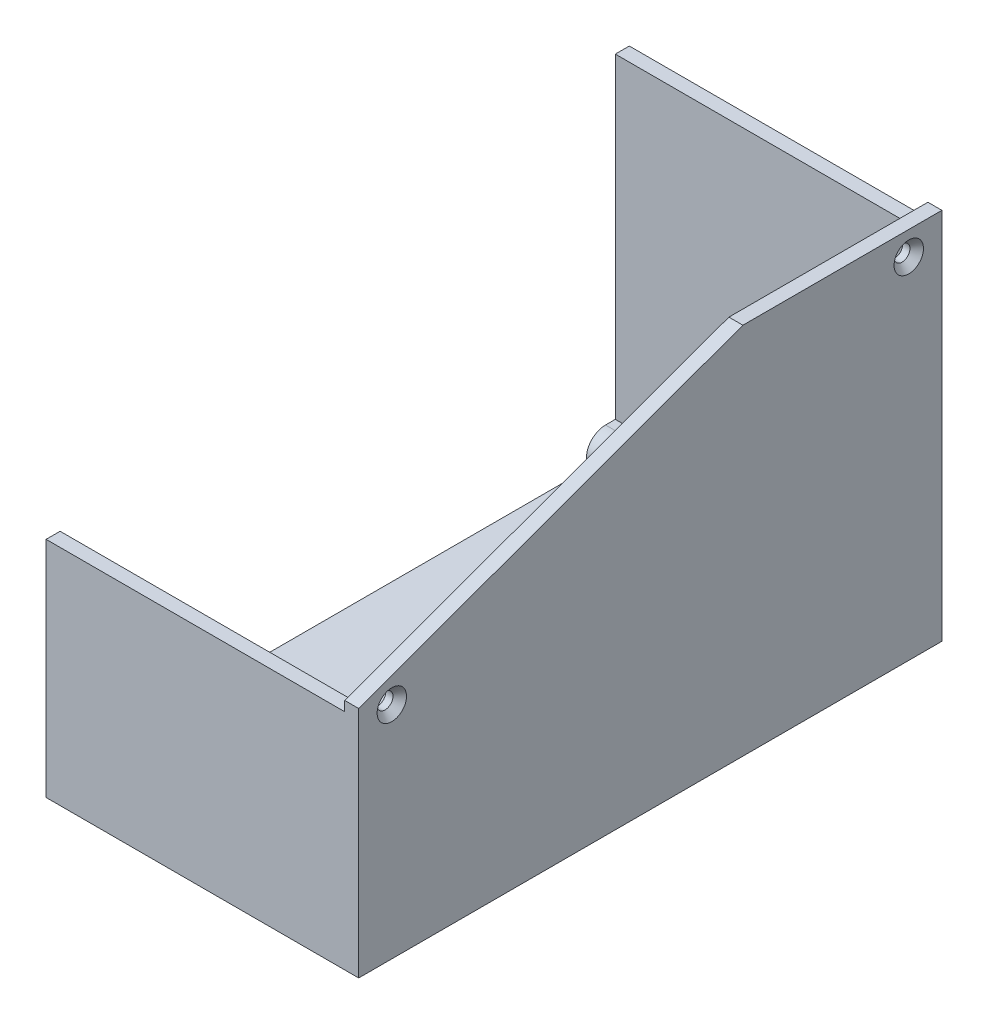
from build123d import *

# Parameters (mm, degrees)
EXTRUDE_1_DEPTH             = 32
EXTRUDE_2_DEPTH             = 3
EXTRUDE_3_DEPTH             = 6
SKETCH_20_3_R               = 2.1
CUT_EXTRUDE_1_DEPTH         = 4
HOLE_WIZARD_M32_D           = 3.4
HOLE_WIZARD_M32_CSINK_D     = 6.3
HOLE_WIZARD_M32_CSINK_ANGLE = 90


with BuildPart() as part:
    # Эскиз18 → Бобышка-Вытянуть1 (new, symmetric)
    with BuildSketch(Plane(origin=(0, 0, 0), x_dir=(0, 0, -1), z_dir=(1, 0, 0))):
        Polygon((53.75, 71), (53.75, -6), (-71.25, -6), (-71.25, 41.928287817), (-68.25, 41.928287817), (-68.25, -3), (50.75, -3), (50.75, 71), align=None)
    extrude(amount=EXTRUDE_1_DEPTH, both=True)

    # Эскиз19 → Бобышка-Вытянуть2 (add)
    with BuildSketch(Plane(origin=(32, 0, 0), x_dir=(0, 0, -1), z_dir=(1, 0, 0))):
        Polygon((-71.25, 44.028910432), (11.094891825, 74), (53.75, 74), (53.75, -6), (-71.25, -6), align=None)
    extrude(amount=EXTRUDE_2_DEPTH)

    # Эскиз20 → Бобышка-Вытянуть3 (add)
    with BuildSketch(Plane.ZY.offset(32)):
        with BuildLine():
            Line((-53.75, 3.2), (-53.75, -6))
            Line((-53.75, -6), (-44.55, -6))
            Line((-44.55, -6), (-44.55, -0.9))
            ThreePointArc((-44.55, -0.9), (-45.750862197, 1.999137803), (-48.65, 3.2))
            Line((-48.65, 3.2), (-53.75, 3.2))
        make_face()
        with BuildLine():
            Line((62.05, -6), (71.25, -6))
            Line((71.25, -6), (71.25, 3.2))
            Line((71.25, 3.2), (66.15, 3.2))
            ThreePointArc((66.15, 3.2), (63.250862197, 1.999137803), (62.05, -0.9))
            Line((62.05, -0.9), (62.05, -6))
        make_face()
    extrude(amount=-EXTRUDE_3_DEPTH)

    # Эскиз20<3> → Вырез-Вытянуть1 (cut)
    with BuildSketch(Plane.ZY.offset(32)):
        with Locations((-48.65, -0.9)):
            Circle(SKETCH_20_3_R)
        with Locations((66.15, -0.9)):
            Circle(SKETCH_20_3_R)
    extrude(amount=-CUT_EXTRUDE_1_DEPTH, mode=Mode.SUBTRACT)

    # Зенковка для винта с потайной головкой M32 (through all)
    with Locations(Plane(origin=(35, 0, 0), x_dir=(0, 0, -1), z_dir=(1, 0, 0))):
        with Locations((-64.15, 41.185792456), (46.65, 68.9)):
            CounterSinkHole(HOLE_WIZARD_M32_D / 2, HOLE_WIZARD_M32_CSINK_D / 2, counter_sink_angle=HOLE_WIZARD_M32_CSINK_ANGLE)


solid = part.part
